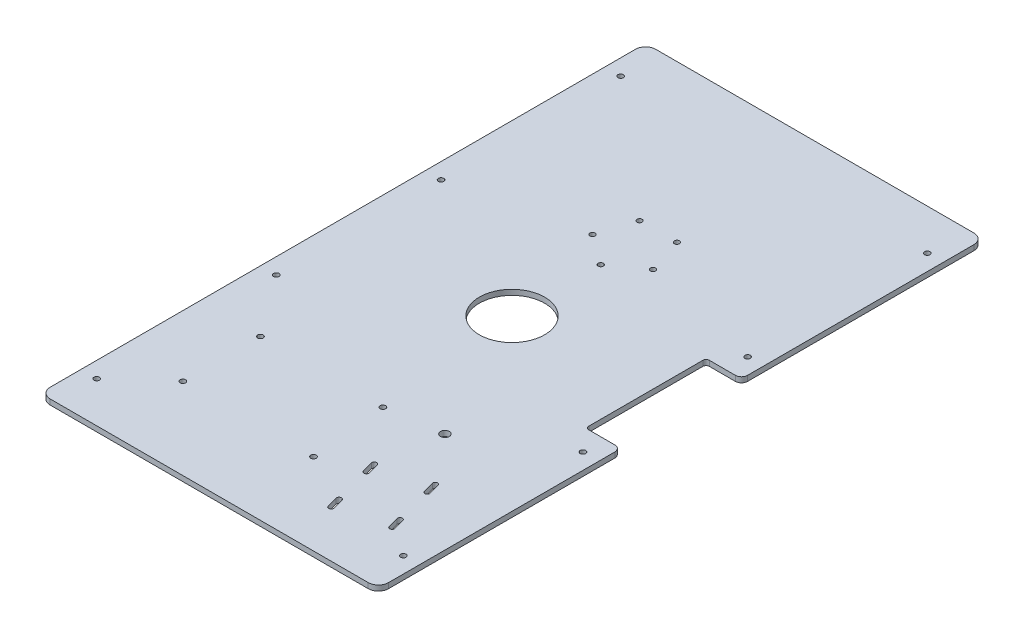
from build123d import *

# Parameters (mm, degrees)
BOSS_EXTRUDE1_DEPTH     = 3.302
M3_CLEARANCE_HOLE1_D    = 3.4
SKETCH6_W               = 210.566
SKETCH6_H               = 3.302
BOSS_EXTRUDE3_DEPTH     = 1.62
SKETCH7_W               = 210.566
SKETCH7_H               = 3.302
BOSS_EXTRUDE4_DEPTH     = 5.18
M3_CLEARANCE_HOLE2_D    = 3.4
SKETCH21_R              = 20.32
CUT_EXTRUDE1_DEPTH      = 336.371396057
ADVANCEDHOLE1_OUTLINE_R = 1.6
ADVANCEDHOLE1_DEPTH     = 3.302
CUT_EXTRUDE2_REACH      = 337.371
SKETCH33_W              = 167.386
SKETCH33_H              = 21.59
FILLET1_R               = 6.35
CUT_EXTRUDE3_DEPTH      = 315.946962825
M5_CLEARANCE_HOLE1_D    = 5.5
M3_CLEARANCE_HOLE3_D    = 3.4
SKETCH40_W              = 22
SKETCH40_H              = 75
CUT_EXTRUDE4_DEPTH      = 315.946962825
FILLET2_R               = 3.81
FILLET3_R               = 2.032


# Read off the part's stored shape, not the designer's step: AdvancedHole1
with BuildPart() as part:
    # Sketch1 → Boss-Extrude1 (new body)
    with BuildSketch(Plane(origin=(0, 0, 0), x_dir=(1, 0, 0), z_dir=(0, 1, 0))):
        Polygon((105.283, -80.01), (105.283, 101.6), (-105.283, 101.6), (-105.283, -80.01), (-83.693, -80.01), (-83.693, -101.6), (83.693, -101.6), (83.693, -80.01), align=None)
    extrude(amount=BOSS_EXTRUDE1_DEPTH)

    # M3 Clearance Hole1 (through all)
    with Locations(Plane(origin=(0, 3.302, 0), x_dir=(1, 0, 0), z_dir=(0, 1, 0))):
        with Locations((-95.377, -54.61), (-95.377, 57.15), (95.377, 57.15), (95.377, -54.61)):
            Hole(M3_CLEARANCE_HOLE1_D / 2)

    # Sketch6 → Boss-Extrude3 (add)
    with BuildSketch(Plane(origin=(0, 0, -101.6), x_dir=(-1, 0, 0), z_dir=(0, 0, -1))):
        with Locations((0, 1.651)):
            Rectangle(SKETCH6_W, SKETCH6_H)
    extrude(amount=BOSS_EXTRUDE3_DEPTH)

    # Sketch7 → Boss-Extrude4 (add)
    with BuildSketch(Plane(origin=(0, 0, -103.22), x_dir=(-1, 0, 0), z_dir=(0, 0, -1))):
        with Locations((0, 1.651)):
            Rectangle(SKETCH7_W, SKETCH7_H)
    extrude(amount=BOSS_EXTRUDE4_DEPTH)


with BuildPart() as body_2:
    # Mirror2: mirrored copy
    add(part.part.mirror(Plane(origin=(0, 0, -108.4), x_dir=(1, 0, 0), z_dir=(0, 0, -1))))


with BuildPart() as part_1:
    add(part.part)

    # Combine1: union body 2
    add(body_2.part)

    # M3 Clearance Hole2 (through all)
    with Locations(Plane(origin=(0, 3.302, 0), x_dir=(1, 0, 0), z_dir=(0, 1, 0))):
        with Locations((-58.293, -91.6), (58.293, -91.6), (-58.293, 308.4), (58.293, 308.4)):
            Hole(M3_CLEARANCE_HOLE2_D / 2)

    # Sketch21 → Cut-Extrude1 (cut, through all)
    with BuildSketch(Plane(origin=(0, 3.302, 0), x_dir=(1, 0, 0), z_dir=(0, 1, 0))):
        with Locations(Location((0, 108.4, 0), (0, 0, 270))):
            Circle(SKETCH21_R)
    extrude(amount=-CUT_EXTRUDE1_DEPTH, mode=Mode.SUBTRACT)

    # AdvancedHole1 outline → AdvancedHole1 (cut)
    with BuildSketch(Plane(origin=(0, 0, 0), x_dir=(1, 0, 0), z_dir=(0, 1, 0))):
        with Locations((-11.624680448, 199.4)):
            Circle(ADVANCEDHOLE1_OUTLINE_R)
        with Locations((-18.809128073, 177.28854382)):
            Circle(ADVANCEDHOLE1_OUTLINE_R)
        with Locations((0, 163.62291236)):
            Circle(ADVANCEDHOLE1_OUTLINE_R)
        with Locations((18.809128073, 177.28854382)):
            Circle(ADVANCEDHOLE1_OUTLINE_R)
        with Locations((11.624680448, 199.4)):
            Circle(ADVANCEDHOLE1_OUTLINE_R)
    extrude(amount=ADVANCEDHOLE1_DEPTH, mode=Mode.SUBTRACT)

    # Sketch33 → Cut-Extrude2 (cut, up to next)
    with BuildSketch(Plane(origin=(0, 3.302, 0), x_dir=(1, 0, 0), z_dir=(0, 1, 0)), mode=Mode.PRIVATE) as cut_extrude2_sk1:
        with Locations((0, 307.605)):
            Rectangle(SKETCH33_W, SKETCH33_H)
    cut_extrude2_tool1 = extrude(cut_extrude2_sk1.sketch, amount=-CUT_EXTRUDE2_REACH, mode=Mode.PRIVATE) & part_1.part
    # Sketch33 → Cut-Extrude2 (cut, up to next)
    with BuildSketch(Plane(origin=(0, 3.302, 0), x_dir=(1, 0, 0), z_dir=(0, 1, 0)), mode=Mode.PRIVATE) as cut_extrude2_sk2:
        with Locations((0, -90.805)):
            Rectangle(SKETCH33_W, SKETCH33_H)
    cut_extrude2_tool2 = extrude(cut_extrude2_sk2.sketch, amount=-CUT_EXTRUDE2_REACH, mode=Mode.PRIVATE) & part_1.part
    add(cut_extrude2_tool1.solids().sort_by_distance((0, 3.302, -307.605))[0], mode=Mode.SUBTRACT)
    add(cut_extrude2_tool2.solids().sort_by_distance((0, 3.302, 90.805))[0], mode=Mode.SUBTRACT)

    # Fillet1
    fillet1_edges = [part_1.edges().sort_by_distance(p)[0] for p in [
        (-105.283, 1.651, 80.01),
        (105.283, 1.651, 80.01),
        (105.283, 1.651, -296.81),
        (-105.283, 1.651, -296.81),
    ]]
    fillet(fillet1_edges, radius=FILLET1_R)

    # Sketch24 → Cut-Extrude3 (cut, through all)
    with BuildSketch(Plane(origin=(0, 3.302, 0), x_dir=(1, 0, 0), z_dir=(0, 1, 0))):
        with BuildLine():
            Line((68.288075685, -5.771611822), (70.099809001, -12.533092606))
            ThreePointArc((70.099809001, -12.533092606), (69.039148829, -14.370209913), (67.202031522, -13.309549741))
            Line((67.202031522, -13.309549741), (65.390298207, -6.548068957))
            ThreePointArc((65.390298207, -6.548068957), (66.450958378, -4.71095165), (68.288075685, -5.771611822))
        make_face()
        with BuildLine():
            Line((76.311466084, -35.715312437), (78.123199399, -42.476793221))
            ThreePointArc((78.123199399, -42.476793221), (77.062539228, -44.313910528), (75.22542192, -43.253250356))
            Line((75.22542192, -43.253250356), (73.413688605, -36.491769572))
            ThreePointArc((73.413688605, -36.491769572), (74.474348777, -34.654652265), (76.311466084, -35.715312437))
        make_face()
        with BuildLine():
            Line((38.34437507, -13.79500222), (40.156108386, -20.556483004))
            ThreePointArc((40.156108386, -20.556483004), (39.095448214, -22.393600311), (37.258330907, -21.332940139))
            Line((37.258330907, -21.332940139), (35.446597592, -14.571459355))
            ThreePointArc((35.446597592, -14.571459355), (36.507257763, -12.734342048), (38.34437507, -13.79500222))
        make_face()
        with BuildLine():
            Line((46.367765469, -43.738702835), (48.179498784, -50.500183619))
            ThreePointArc((48.179498784, -50.500183619), (47.118838613, -52.337300926), (45.281721306, -51.276640754))
            Line((45.281721306, -51.276640754), (43.46998799, -44.51515997))
            ThreePointArc((43.46998799, -44.51515997), (44.530648162, -42.678042663), (46.367765469, -43.738702835))
        make_face()
    extrude(amount=-CUT_EXTRUDE3_DEPTH, mode=Mode.SUBTRACT)

    # M5 Clearance Hole1 (through all)
    with Locations(Plane(origin=(0, 3.302, 0), x_dir=(1, 0, 0), z_dir=(0, 1, 0))):
        with Locations((42.731024346, 23.92564608)):
            Hole(M5_CLEARANCE_HOLE1_D / 2)

    # M3 Clearance Hole3 (through all)
    with Locations(Plane(origin=(0, 3.302, 0), x_dir=(1, 0, 0), z_dir=(0, 1, 0))):
        with Locations((9.017, 19.05), (14.097, -29.21), (-67.183, 19.05), (-67.183, -29.21)):
            Hole(M3_CLEARANCE_HOLE3_D / 2)

    # Sketch40 → Cut-Extrude4 (cut, through all)
    with BuildSketch(Plane(origin=(0, 3.302, 0), x_dir=(1, 0, 0), z_dir=(0, 1, 0))):
        with Locations((94.283, 108.4)):
            Rectangle(SKETCH40_W, SKETCH40_H)
    extrude(amount=-CUT_EXTRUDE4_DEPTH, mode=Mode.SUBTRACT)

    # Fillet2
    fillet2_edges = [part_1.edges().sort_by_distance(p)[0] for p in [
        (105.283, 1.651, -145.9),
        (105.283, 1.651, -70.9),
    ]]
    fillet(fillet2_edges, radius=FILLET2_R)

    # Fillet3
    fillet3_edges = [part_1.edges().sort_by_distance(p)[0] for p in [
        (83.283, 1.651, -70.9),
        (83.283, 1.651, -145.9),
    ]]
    fillet(fillet3_edges, radius=FILLET3_R)


solid = part_1.part
